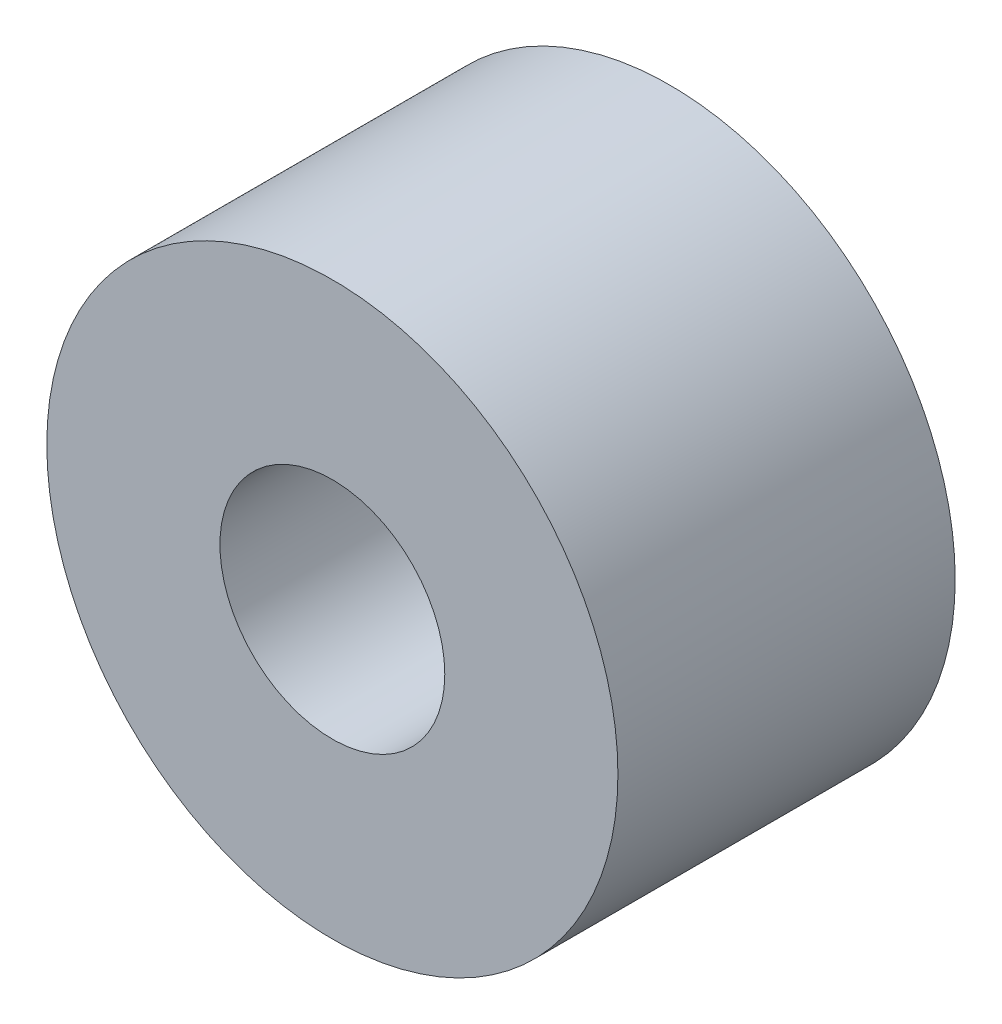
from build123d import *

# Parameters (mm, degrees)
SKETCH1_R           = 25.4
BOSS_EXTRUDE1_DEPTH = 30
SKETCH2_R           = 10
CUT_EXTRUDE1_DEPTH  = 47.800854693


with BuildPart() as part:
    # Sketch1 → Boss-Extrude1 (new body)
    with BuildSketch(Plane.XY):
        Circle(SKETCH1_R)
    extrude(amount=BOSS_EXTRUDE1_DEPTH)

    # Sketch2 → Cut-Extrude1 (cut, through all)
    with BuildSketch(Plane.XY.offset(30)):
        Circle(SKETCH2_R)
    extrude(amount=-CUT_EXTRUDE1_DEPTH, mode=Mode.SUBTRACT)


solid = part.part
